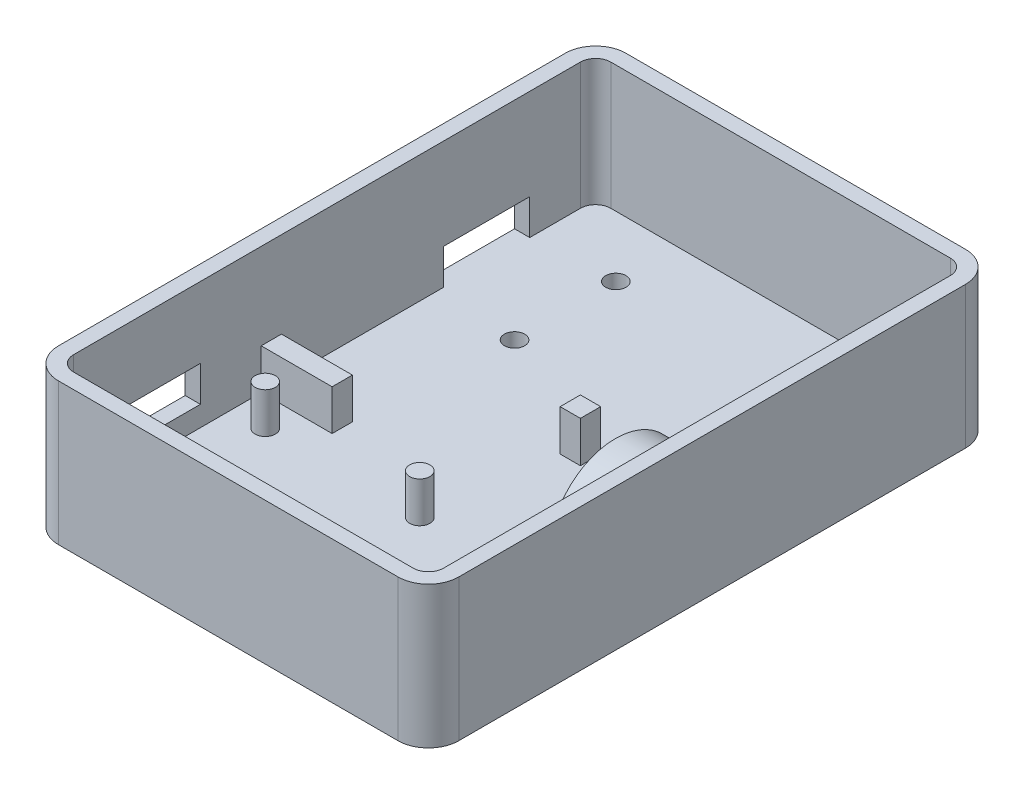
from build123d import *

# Parameters (mm, degrees)
SKETCH2_W            = 39.5
SKETCH2_H            = 56
BOSS_EXTRUDE1_DEPTH  = 14
FILLET1_R            = 3
SHELL1_T             = -1.5
SKETCH3_W            = 7
SKETCH3_H            = 2
SKETCH3_W_2          = 2
SKETCH3_H_2          = 5
BOSS_EXTRUDE3_DEPTH  = 4
SKETCH4_W            = 2
SKETCH4_H            = 2
BOSS_EXTRUDE4_DEPTH  = 4.052221169
SKETCH6_W            = 8
SKETCH6_H            = 3.5
CUT_EXTRUDE1_DEPTH   = 70.108610173
SKETCH7_R            = 1
BOSS_EXTRUDE5_DEPTH  = 4
SKETCH8_W            = 8.5
SKETCH8_H            = 3.5
CUT_EXTRUDE2_DEPTH   = 70.108610173
SKETCH12_R           = 6.5
BOSS_EXTRUDE7_DEPTH  = 3.5
SKETCH13_R           = 5.15
CUT_EXTRUDE5_DEPTH   = 3.5
SKETCH15_W           = 1.3
SKETCH15_H           = 3.704358433
BOSS_EXTRUDE8_DEPTH  = 3.5
SKETCH16_W           = 2.3
SKETCH16_H           = 1.398241718
BOSS_EXTRUDE9_DEPTH  = 3.5
SKETCH17_W           = 1.2
SKETCH17_H           = 5.421175269
BOSS_EXTRUDE10_DEPTH = 3.5
SKETCH18_W           = 2.4
SKETCH18_H           = 1.320829883
BOSS_EXTRUDE12_DEPTH = 3.5
SKETCH21_W           = 4
SKETCH21_H           = 3
CUT_EXTRUDE6_DEPTH   = 3.5
SKETCH22_R           = 1
CUT_EXTRUDE7_DEPTH   = 70.659888027
SKETCH28_R           = 1
CUT_EXTRUDE10_DEPTH  = 70.659888027


with BuildPart() as part:
    # Sketch2 → Boss-Extrude1 (new body)
    with BuildSketch(Plane(origin=(0, 0, 0), x_dir=(1, 0, 0), z_dir=(0, 1, 0))):
        with Locations((19.75, 28)):
            Rectangle(SKETCH2_W, SKETCH2_H)
    extrude(amount=BOSS_EXTRUDE1_DEPTH)

    # Fillet1
    fillet1_edges = [part.edges().sort_by_distance(p)[0] for p in [
        (0, 7, 0),
        (0, 7, -56),
        (39.5, 7, -56),
        (39.5, 7, 0),
    ]]
    fillet(fillet1_edges, radius=FILLET1_R)

    # Shell1
    shell1_openings = [part.faces().sort_by_distance(p)[0] for p in [
        (19.75, 14, -28),
    ]]
    offset(amount=SHELL1_T, openings=shell1_openings, kind=Kind.INTERSECTION)

    # Sketch3 → Boss-Extrude3 (add)
    with BuildSketch(Plane(origin=(0, 1.5, 0), x_dir=(1, 0, 0), z_dir=(0, 1, 0))):
        with Locations((5, 22.5)):
            Rectangle(SKETCH3_W, SKETCH3_H)
        with Locations((23.5, 4)):
            Rectangle(SKETCH3_W_2, SKETCH3_H_2)
    extrude(amount=BOSS_EXTRUDE3_DEPTH)

    # Sketch4 → Boss-Extrude4 (add)
    with BuildSketch(Plane(origin=(0, 1.5, 0), x_dir=(1, 0, 0), z_dir=(0, 1, 0))):
        with Locations((22.5, 32)):
            Rectangle(SKETCH4_W, SKETCH4_H)
    extrude(amount=BOSS_EXTRUDE4_DEPTH)

    # Sketch6 → Cut-Extrude1 (cut, through all)
    with BuildSketch(Plane(origin=(1.5, 0, 0), x_dir=(0, 0, -1), z_dir=(1, 0, 0))):
        with Locations((11.5, 5.25)):
            Rectangle(SKETCH6_W, SKETCH6_H)
    extrude(amount=-CUT_EXTRUDE1_DEPTH, mode=Mode.SUBTRACT)

    # Sketch7 → Boss-Extrude5 (add)
    with BuildSketch(Plane(origin=(0, 1.5, 0), x_dir=(1, 0, 0), z_dir=(0, 1, 0))):
        with Locations((4.75, 18.65)):
            Circle(SKETCH7_R)
        with Locations((20, 18.65)):
            Circle(SKETCH7_R)
        with Locations((4.75, 4.35)):
            Circle(SKETCH7_R)
        with Locations((20, 4.35)):
            Circle(SKETCH7_R)
    extrude(amount=BOSS_EXTRUDE5_DEPTH)

    # Sketch8 → Cut-Extrude2 (cut, through all)
    with BuildSketch(Plane(origin=(1.5, 0, 0), x_dir=(0, 0, -1), z_dir=(1, 0, 0))):
        with Locations((43.75, 3.25)):
            Rectangle(SKETCH8_W, SKETCH8_H)
    extrude(amount=-CUT_EXTRUDE2_DEPTH, mode=Mode.SUBTRACT)

    # Sketch12 → Boss-Extrude7 (add)
    with BuildSketch(Plane.ZY.offset(-38)):
        with Locations((-23.469922622, 6.6)):
            Circle(SKETCH12_R)
    extrude(amount=BOSS_EXTRUDE7_DEPTH)

    # Sketch13 → Cut-Extrude5 (cut)
    with BuildSketch(Plane.ZY.offset(-34.5)):
        with Locations((-23.469922622, 6.6)):
            Circle(SKETCH13_R)
    extrude(amount=-CUT_EXTRUDE5_DEPTH, mode=Mode.SUBTRACT)

    # Sketch15 → Boss-Extrude8 (add)
    with BuildSketch(Plane.ZY.offset(-38)):
        with Locations((-29.146876513, 3.352179217)):
            Rectangle(SKETCH15_W, SKETCH15_H)
    extrude(amount=BOSS_EXTRUDE8_DEPTH)

    # Sketch16 → Boss-Extrude9 (add)
    with BuildSketch(Plane.ZY.offset(-38)):
        with Locations((-28.646876513, 2.199120859)):
            Rectangle(SKETCH16_W, SKETCH16_H)
    extrude(amount=BOSS_EXTRUDE9_DEPTH)

    # Sketch17 → Boss-Extrude10 (add)
    with BuildSketch(Plane.ZY.offset(-38)):
        with Locations((-17.651553886, 4.210587635)):
            Rectangle(SKETCH17_W, SKETCH17_H)
    extrude(amount=BOSS_EXTRUDE10_DEPTH)

    # Sketch18 → Boss-Extrude12 (add)
    with BuildSketch(Plane.ZY.offset(-38)):
        with Locations((-18.251553886, 2.160414942)):
            Rectangle(SKETCH18_W, SKETCH18_H)
    extrude(amount=BOSS_EXTRUDE12_DEPTH)

    # Sketch21 → Cut-Extrude6 (cut)
    with BuildSketch(Plane.ZY.offset(-34.5)):
        with Locations((-28.400298424, 7.23482229)):
            Rectangle(SKETCH21_W, SKETCH21_H)
    extrude(amount=-CUT_EXTRUDE6_DEPTH, mode=Mode.SUBTRACT)

    # Sketch22 → Cut-Extrude7 (cut, through all)
    with BuildSketch(Plane(origin=(0, 1.5, 0), x_dir=(1, 0, 0), z_dir=(0, 1, 0))):
        with Locations((9.5, 38.5)):
            Circle(SKETCH22_R)
    extrude(amount=-CUT_EXTRUDE7_DEPTH, mode=Mode.SUBTRACT)

    # Sketch28 → Cut-Extrude10 (cut, through all)
    with BuildSketch(Plane(origin=(0, 1.5, 0), x_dir=(1, 0, 0), z_dir=(0, 1, 0))):
        with Locations((9.5, 48.5)):
            Circle(SKETCH28_R)
    extrude(amount=-CUT_EXTRUDE10_DEPTH, mode=Mode.SUBTRACT)


solid = part.part
